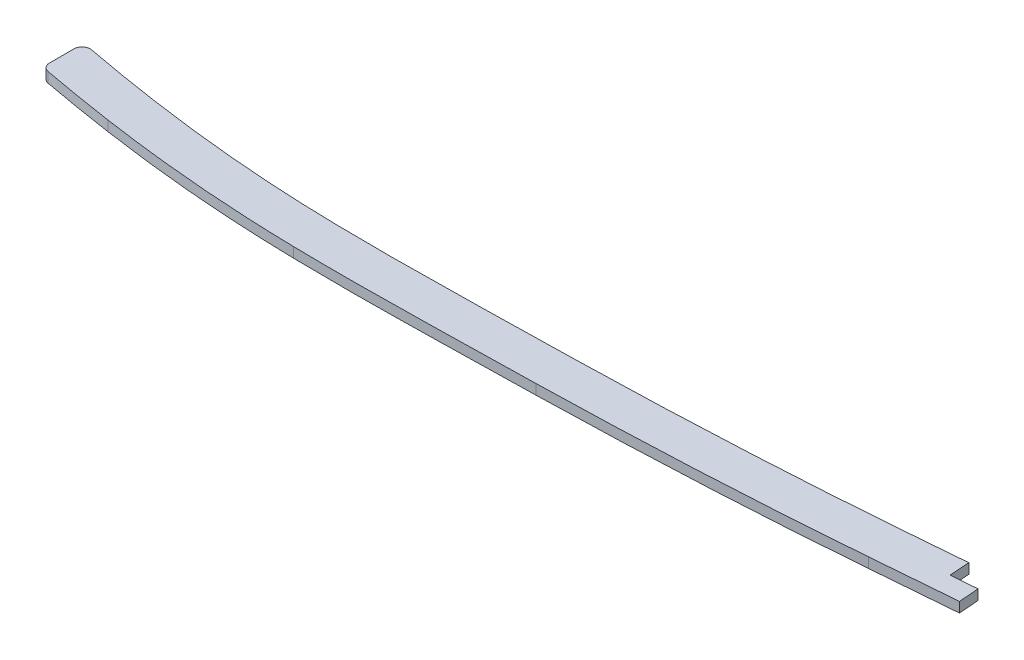
from build123d import *

# Parameters (mm, degrees)
BOSS_EXTRUDE1_START = -1.5875
BOSS_EXTRUDE1_DEPTH = 3.175
FILLET1_R           = 2.54
CUT_EXTRUDE1_DEPTH  = 10.16


# Read off the part's stored shape, not the designer's step: Boss-Extrude1
with BuildPart() as part:
    # Boss-Extrude1 outline → Boss-Extrude1 (new body)
    with BuildSketch(Plane(origin=(0, 0, 0), x_dir=(1, 0, 0), z_dir=(0, 1, 0)).offset(BOSS_EXTRUDE1_START)):
        with BuildLine():
            add(Edge.make_bspline(
                [(701.573370465, -71.674259434), (702.04697488, -71.626796619), (702.961854911, -71.534187022), (704.527211696, -71.372087014), (706.256268563, -71.189411511), (708.433468196, -70.954566837), (711.038260137, -70.66442021), (715.259153852, -70.176918919), (720.517449562, -69.537326192), (728.939784684, -68.449094171), (739.471043309, -66.973596397), (752.121699379, -65.058370184), (764.774270693, -63.022725712), (775.332382372, -61.245644149), (783.768221701, -59.789793136), (790.217423582, -58.659365862), (795.556531692, -57.710632329), (799.706029598, -56.965839367), (801.743713725, -56.597532565), (802.76701547, -56.411910209)],
                knots=[1.1996e-05, 1.1996e-05, 1.1996e-05, 1.1996e-05, 0.015636808, 0.031261621, 0.046886433, 0.062511246, 0.093760871, 0.125010496, 0.187509746, 0.250008997, 0.375007497, 0.500005998, 0.625004498, 0.750002999, 0.812502249, 0.875001499, 0.93750075, 0.968750375, 1, 1, 1, 1], degree=3))
            add(Edge.make_bspline(
                [(696.057912544, -72.218303811), (696.516819195, -72.173843609), (697.434189716, -72.08448281), (698.812500771, -71.948951554), (700.191895387, -71.812223809), (701.113019016, -71.720314305), (701.573370465, -71.674259434)],
                knots=[0.000436824, 0.000436824, 0.000436824, 0.000436824, 0.250279009, 0.500121194, 0.749963378, 0.999805563, 0.999805563, 0.999805563, 0.999805563], degree=3))
            add(Edge.make_bspline(
                [(684.465771861, -73.258588893), (685.427037387, -73.178353817), (687.338409796, -73.01607439), (690.270265001, -72.757917882), (693.135698373, -72.496722872), (695.087462196, -72.311946881), (696.057912544, -72.218303811)],
                knots=[-3.996e-06, -3.996e-06, -3.996e-06, -3.996e-06, 0.249945754, 0.499895504, 0.749845254, 0.999795004, 0.999795004, 0.999795004, 0.999795004], degree=3))
            add(Edge.make_bspline(
                [(602.42420841, -79.030202072), (604.074214061, -78.917973041), (607.327656264, -78.697993222), (612.488020924, -78.352754528), (617.82142797, -77.998720132), (624.748165187, -77.541006681), (633.288768179, -76.978079707), (643.562499486, -76.293021789), (653.811394813, -75.590339748), (662.341271598, -74.981221252), (669.157253218, -74.473896148), (673.963588211, -74.106706625), (678.141033863, -73.776630779), (681.719672317, -73.486306526), (683.554235836, -73.334679882), (684.465771861, -73.258588893)],
                knots=[4.679e-06, 4.679e-06, 4.679e-06, 4.679e-06, 0.062504419, 0.125004159, 0.1875039, 0.25000364, 0.375003121, 0.500002601, 0.625002082, 0.750001563, 0.812501303, 0.875001043, 0.937500783, 0.968750654, 1.000000524, 1.000000524, 1.000000524, 1.000000524], degree=3))
            add(Edge.make_bspline(
                [(520.17866376, -85.310815783), (520.948622537, -85.247475703), (522.472990474, -85.121954498), (525.646023872, -84.860432492), (529.954540392, -84.505420462), (535.485636827, -84.050761487), (540.7029418, -83.623505808), (545.828810606, -83.207047886), (550.972711882, -82.793890253), (556.116782859, -82.386921041), (562.976897794, -81.853433898), (571.571389273, -81.203899916), (581.568137842, -80.474939815), (590.024015055, -79.880194977), (597.052441707, -79.396103056), (600.639671821, -79.151478022), (602.42420841, -79.030202072)],
                knots=[1.3823e-05, 1.3823e-05, 1.3823e-05, 1.3823e-05, 0.031263258, 0.062512694, 0.125011564, 0.187510435, 0.250009305, 0.312508176, 0.375007046, 0.437505917, 0.500004787, 0.625002528, 0.750000269, 0.87499801, 0.937496881, 0.999995751, 0.999995751, 0.999995751, 0.999995751], degree=3))
            add(Edge.make_bspline(
                [(421.564796931, -90.347249187), (422.61109619, -90.324190198), (424.721066812, -90.275643156), (427.781390104, -90.199626606), (430.822063258, -90.118782847), (434.941029322, -90.002532976), (440.08484045, -89.844168641), (452.427619866, -89.421521336), (466.822115937, -88.804267378), (483.25535308, -87.910089241), (493.52068453, -87.276342604), (501.726177762, -86.718361924), (507.872215251, -86.275368153), (512.780927318, -85.902800926), (516.950869137, -85.573515025), (519.108912611, -85.398645627), (520.17866376, -85.310815783)],
                knots=[7.203e-06, 7.203e-06, 7.203e-06, 7.203e-06, 0.031256675, 0.062506146, 0.093755618, 0.125005089, 0.187504032, 0.250002975, 0.499998747, 0.624996633, 0.749994519, 0.812493462, 0.874992405, 0.937491348, 0.968740819, 0.999990291, 0.999990291, 0.999990291, 0.999990291], degree=3))
            add(Edge.make_bspline(
                [(346.714675087, -91.169822314), (347.184634959, -91.179549272), (348.149283989, -91.198362445), (349.881001429, -91.228640124), (351.370820969, -91.250109563), (353.638345707, -91.276445536), (356.741777131, -91.30289862), (360.603346067, -91.318288447), (365.253131479, -91.312388009), (369.910166762, -91.284169995), (376.135587827, -91.222367993), (383.937832745, -91.109503558), (391.757720532, -90.96544109), (398.23665113, -90.836219907), (403.230594411, -90.734014325), (408.182903858, -90.630969164), (412.914025095, -90.531986169), (416.611599734, -90.454119205), (419.474951766, -90.392792196), (420.864689854, -90.36259776), (421.564796931, -90.347249187)],
                knots=[1.1e-08, 1.1e-08, 1.1e-08, 1.1e-08, 0.015624829, 0.031249657, 0.062499315, 0.093748972, 0.12499863, 0.187497945, 0.24999726, 0.312496575, 0.37499589, 0.49999452, 0.62499315, 0.687492464, 0.749991779, 0.812491094, 0.874990409, 0.937489724, 0.968739382, 0.999989039, 0.999989039, 0.999989039, 0.999989039], degree=3))
            add(Edge.make_bspline(
                [(284.660180705, -86.02436228), (285.273667186, -86.114656759), (286.466569449, -86.288293963), (288.463107874, -86.571590524), (290.46491743, -86.848444068), (293.02699573, -87.19252046), (296.252166304, -87.606710304), (301.400962421, -88.226261718), (307.844767088, -88.921476193), (315.590478493, -89.626291032), (322.05207179, -90.106744711), (327.225920355, -90.425587153), (330.470644664, -90.599377294), (333.059733967, -90.723413499), (335.02192621, -90.809363102), (336.835778016, -90.883623075), (338.1694462, -90.935956115), (339.489700776, -90.98142965), (341.397886756, -91.039617592), (343.443225624, -91.094945655), (345.255837503, -91.138480537), (346.23440638, -91.159881953), (346.714675087, -91.169822314)],
                knots=[0, 0, 0, 0, 0.03125, 0.0625, 0.09375, 0.125, 0.1875, 0.25, 0.375, 0.5, 0.625, 0.6875, 0.75, 0.78125, 0.8125, 0.84375, 0.875, 0.90625, 0.9375, 0.96875, 0.984375, 1, 1, 1, 1], degree=3))
            add(Edge.make_bspline(
                [(258.083552795, -81.475395447), (258.347968296, -81.526862936), (258.876883054, -81.629439687), (259.670508063, -81.782232521), (260.729004783, -81.984533344), (265.19336261, -82.828339408), (273.252215122, -84.264018509), (280.795301047, -85.455519597), (284.660180705, -86.02436228)],
                knots=[0.425011658, 0.425011658, 0.425011658, 0.425011658, 0.442241189, 0.459470721, 0.476700252, 0.511159315, 0.75, 1, 1, 1, 1], degree=3))
            Line((258.083552795, -81.475395447), (258.083552795, -94.40861288))
            add(Edge.make_bspline(
                [(282.810885884, -98.588999508), (274.906267762, -97.425577983), (267.032082315, -96.096692803), (258.818160589, -94.548151889), (258.450825612, -94.478551371), (258.083552795, -94.40861288)],
                knots=[0, 0, 0, 0, 0.5, 0.5, 0.523411439, 0.523411439, 0.523411439, 0.523411439], degree=3))
            add(Edge.make_bspline(
                [(282.810885884, -98.588999508), (283.589001764, -98.703524555), (285.164508504, -98.932181064), (287.829592849, -99.306686744), (290.382113422, -99.652796041), (292.96654593, -99.989964246), (295.582618612, -100.317621114), (298.230083081, -100.634886778), (300.908649594, -100.941019762), (303.61800528, -101.235303734), (306.357810596, -101.517085869), (309.127700691, -101.785780175), (311.92729165, -102.040857239), (316.290106771, -102.412643883), (322.527800913, -102.877083333), (328.625603501, -103.227822262), (333.380129051, -103.452212237), (336.816790701, -103.594408746), (339.260438836, -103.686034081), (343.688375923, -103.809905452), (346.451873128, -103.867102934)],
                knots=[0, 0, 0, 0, 0.039344948, 0.07917436, 0.119484401, 0.160271019, 0.201529957, 0.243256752, 0.285446746, 0.328095093, 0.37119677, 0.414746584, 0.458739194, 0.503169123, 0.620303495, 0.752369719, 0.789892337, 0.843756099, 0.913843268, 1, 1, 1, 1], degree=3))
            add(Edge.make_bspline(
                [(346.451873128, -103.867102934), (347.517721695, -103.889163254), (349.542313965, -103.92559437), (351.410670783, -103.951601003), (353.733077388, -103.97802022), (356.595805361, -104.001616052), (359.303450326, -104.013254143), (361.856652408, -104.015647305), (363.59855953, -104.013876583), (367.980988834, -104.00146953), (374.772600805, -103.943346872), (385.553908564, -103.787153573), (397.279033824, -103.561287268), (410.957604412, -103.27591363), (418.412993695, -103.119398813), (421.843885938, -103.044182276)],
                knots=[0, 0, 0, 0, 0.033933195, 0.066295354, 0.097094988, 0.12634023, 0.180197875, 0.204824218, 0.227923989, 0.249502809, 0.379187752, 0.498147003, 0.678500622, 0.845778388, 1, 1, 1, 1], degree=3))
            add(Edge.make_bspline(
                [(421.843885938, -103.044182276), (423.284501257, -103.01243375), (426.138074601, -102.945774905), (430.23392379, -102.840101392), (434.371968877, -102.72425222), (439.798819101, -102.559925422), (448.025157593, -102.283759658), (459.021003941, -101.848637215), (471.45249354, -101.271082202), (483.913686147, -100.593406887), (494.231772367, -99.956980278), (502.466387344, -99.39745886), (508.578998405, -98.957752379), (514.573610191, -98.503827918), (518.958126171, -98.153760061), (521.218891036, -97.968142841)],
                knots=[0, 0, 0, 0, 0.042442699, 0.084473439, 0.126075796, 0.167232557, 0.248140272, 0.374197286, 0.498957981, 0.623287397, 0.750390596, 0.810583593, 0.872090979, 0.935130561, 1, 1, 1, 1], degree=3))
            add(Edge.make_bspline(
                [(521.218891036, -97.968142841), (523.451350188, -97.784491424), (528.137879673, -97.397889698), (536.731309482, -96.690817555), (544.954460679, -96.018267543), (553.50407331, -95.33057133), (563.716480518, -94.531063336), (575.636513939, -93.635190253), (588.786212869, -92.692538058), (598.347131864, -92.036570917), (603.285671904, -91.700951094)],
                knots=[0, 0, 0, 0, 0.091538543, 0.187736577, 0.288050862, 0.392265043, 0.500367872, 0.66142166, 0.827962884, 1, 1, 1, 1], degree=3))
            add(Edge.make_bspline(
                [(603.285671904, -91.700951094), (605.78808228, -91.530743591), (610.897032353, -91.186403467), (619.306599861, -90.627823918), (627.538601032, -90.084789882), (635.936476676, -89.530098998), (643.719546666, -89.009847824), (650.893783861, -88.520535985), (657.46530725, -88.061941255), (664.220349455, -87.576914876), (671.158631923, -87.060362733), (677.768426526, -86.549575155), (682.892578542, -86.13408317), (685.522190682, -85.9145748)],
                knots=[0, 0, 0, 0, 0.096041268, 0.194096291, 0.29416615, 0.396252661, 0.500358628, 0.578021943, 0.657927659, 0.740076076, 0.824468696, 0.911108458, 1, 1, 1, 1], degree=3))
            add(Edge.make_bspline(
                [(685.522190682, -85.9145748), (686.483363358, -85.834347474), (688.416317483, -85.670266195), (691.375399642, -85.409794673), (694.295027309, -85.143745348), (696.281480154, -84.95572275), (697.280162315, -84.859352478)],
                knots=[0, 0, 0, 0, 0.247890437, 0.497182912, 0.747883707, 1, 1, 1, 1], degree=3))
            add(Edge.make_bspline(
                [(697.280162315, -84.859352478), (699.133498258, -84.679799353), (700.986276607, -84.496390936), (702.838684367, -84.311070025)],
                knots=[0, 0, 0, 0, 1, 1, 1, 1], degree=3))
            add(Edge.make_bspline(
                [(702.838684367, -84.311070025), (703.589775295, -84.235799752), (705.133492987, -84.078629058), (708.047466313, -83.771407142), (710.748991263, -83.476233306), (713.523455705, -83.162791229), (716.37085234, -82.830812164), (719.291149506, -82.479719712), (722.284334057, -82.109050619), (725.350396028, -81.718303946), (730.760173437, -81.009658613), (740.331799838, -79.683632118), (753.598097399, -77.68903736), (767.27468421, -75.481732644), (778.677358422, -73.559116698), (788.170711893, -71.915943965), (796.891357387, -70.375844053), (802.366731643, -69.391771369), (805.033747795, -68.907986576)],
                knots=[0, 0, 0, 0, 0.024848372, 0.050416521, 0.076704883, 0.103713975, 0.131444397, 0.159896834, 0.189072062, 0.218970945, 0.249594443, 0.347406526, 0.499390399, 0.638902952, 0.749436379, 0.834969029, 0.918499168, 1, 1, 1, 1], degree=3))
            Line((805.033747795, -68.907986576), (806.809551789, -68.578936168))
            add(Edge.make_bspline(
                [(806.809551789, -68.578936168), (807.794004822, -68.395119755), (809.726191369, -68.029713589), (811.766757719, -67.634799792), (814.185248792, -67.158567155), (816.55886725, -66.68111941), (820.369254046, -65.898841142), (824.807312319, -64.951185469), (829.827239229, -63.826217582), (833.268092373, -63.026324522), (835.935211118, -62.389425037), (837.873162846, -61.91853539), (839.769381429, -61.449895816), (841.624127129, -60.983575945), (843.734931971, -60.443149682), (844.733875611, -60.183258894), (845.223156672, -60.055102096)],
                knots=[0, 0, 0, 0, 0.064848776, 0.128591831, 0.191223632, 0.252742215, 0.313148507, 0.487734154, 0.598660779, 0.705288655, 0.75701083, 0.807682273, 0.85731034, 0.905901891, 0.953463218, 1, 1, 1, 1], degree=3))
            add(Edge.make_bspline(
                [(858.805970467, -56.257210913), (854.302265416, -57.602424975), (849.773135735, -58.863331563), (845.223156672, -60.055102096)],
                knots=[0.525572557, 0.525572557, 0.525572557, 0.525572557, 1, 1, 1, 1], degree=3))
            Line((858.805970467, -56.257210913), (858.805970467, -42.981654463))
            add(Edge.make_bspline(
                [(842.005216089, -47.769547229), (844.33209519, -47.160070589), (848.630876213, -45.996859499), (853.420502494, -44.614540459), (856.161610787, -43.791878163), (857.220661541, -43.470009626), (858.013965236, -43.226852548), (858.542087125, -43.063586295), (858.805970467, -42.981654463)],
                knots=[0, 0, 0, 0, 0.25, 0.462204418, 0.52007177, 0.549005446, 0.577939123, 0.606872799, 0.606872799, 0.606872799, 0.606872799], degree=3))
            add(Edge.make_bspline(
                [(804.478503109, -56.094697623), (804.937261418, -56.009038578), (805.873535899, -55.833158182), (807.593890186, -55.506511486), (809.223478159, -55.191529302), (811.577863033, -54.728351346), (814.728198308, -54.095426794), (818.65467417, -53.281335813), (823.355137668, -52.264852214), (828.043123472, -51.207419322), (831.9339187, -50.292144023), (835.047083584, -49.53591133), (836.970069876, -49.058975401), (838.551971708, -48.659746263), (839.885294081, -48.319263071), (841.0585054, -48.016793361), (841.676038434, -47.855768334), (842.005216089, -47.769547229)],
                knots=[0, 0, 0, 0, 0.03125, 0.0625, 0.125, 0.1875, 0.25, 0.375, 0.5, 0.625, 0.75, 0.8125, 0.875, 0.90625, 0.9375, 0.96875, 1, 1, 1, 1], degree=3))
            Line((804.478503109, -56.094697623), (802.76701547, -56.411910209))
        make_face()
    extrude(amount=BOSS_EXTRUDE1_DEPTH)

    # Fillet1
    fillet1_edges = [part.edges().sort_by_distance(p)[0] for p in [
        (858.805970467, 0, 42.981654463),
        (858.805970467, 0, 56.257210913),
        (258.083552795, 0, 81.475395447),
        (258.083552795, 0, 94.40861288),
    ]]
    fillet(fillet1_edges, radius=FILLET1_R)

    # Sketch3 → Cut-Extrude1 (cut)
    with BuildSketch(Plane(origin=(0, 1.5875, 0), x_dir=(1, 0, 0), z_dir=(0, 1, 0))):
        with BuildLine():
            Line((538.573908081, -83.797990994), (539.029351184, -90.069007907))
            Line((539.029351184, -90.069007907), (547.151700891, -89.47910866))
            Line((547.151700891, -89.47910866), (547.661463933, -95.801226886))
            add(Edge.make_bspline(
                [(547.661463933, -95.801226886), (549.573540603, -95.647052923), (554.442098815, -95.257135276), (563.716480518, -94.531063336), (575.636513939, -93.635190253), (588.786212869, -92.692538058), (598.347131864, -92.036570917), (603.285671904, -91.700951094)],
                knots=[0.322345551, 0.322345551, 0.322345551, 0.322345551, 0.392265043, 0.500367872, 0.66142166, 0.827962884, 1, 1, 1, 1], degree=3))
            add(Edge.make_bspline(
                [(603.285671904, -91.700951094), (605.78808228, -91.530743591), (610.897032353, -91.186403467), (619.306599861, -90.627823918), (627.538601032, -90.084789882), (635.936476676, -89.530098998), (643.719546666, -89.009847824), (650.893783861, -88.520535985), (657.46530725, -88.061941255), (664.220349455, -87.576914876), (671.158631923, -87.060362733), (677.768426526, -86.549575155), (682.892578542, -86.13408317), (685.522190682, -85.9145748)],
                knots=[0, 0, 0, 0, 0.096041268, 0.194096291, 0.29416615, 0.396252661, 0.500358628, 0.578021943, 0.657927659, 0.740076076, 0.824468696, 0.911108458, 1, 1, 1, 1], degree=3))
            add(Edge.make_bspline(
                [(685.522190682, -85.9145748), (686.483363358, -85.834347474), (688.416317483, -85.670266195), (691.375399642, -85.409794673), (694.295027309, -85.143745348), (696.281480154, -84.95572275), (697.280162315, -84.859352478)],
                knots=[0, 0, 0, 0, 0.247890437, 0.497182912, 0.747883707, 1, 1, 1, 1], degree=3))
            add(Edge.make_bspline(
                [(697.280162315, -84.859352478), (699.133498258, -84.679799353), (700.986276607, -84.496390936), (702.838684367, -84.311070025)],
                knots=[0, 0, 0, 0, 1, 1, 1, 1], degree=3))
            add(Edge.make_bspline(
                [(702.838684367, -84.311070025), (703.589775295, -84.235799752), (705.133492987, -84.078629058), (708.047466313, -83.771407142), (710.748991263, -83.476233306), (713.523455705, -83.162791229), (716.37085234, -82.830812164), (719.291149506, -82.479719712), (722.284334057, -82.109050619), (725.350396028, -81.718303946), (730.760173437, -81.009658613), (740.331799838, -79.683632118), (753.598097399, -77.68903736), (767.27468421, -75.481732644), (778.677358422, -73.559116698), (788.170711893, -71.915943965), (796.891357387, -70.375844053), (802.366731643, -69.391771369), (805.033747795, -68.907986576)],
                knots=[0, 0, 0, 0, 0.024848372, 0.050416521, 0.076704883, 0.103713975, 0.131444397, 0.159896834, 0.189072062, 0.218970945, 0.249594443, 0.347406526, 0.499390399, 0.638902952, 0.749436379, 0.834969029, 0.918499168, 1, 1, 1, 1], degree=3))
            Line((805.033747795, -68.907986576), (806.809551789, -68.578936168))
            add(Edge.make_bspline(
                [(806.809551789, -68.578936168), (807.794004822, -68.395119755), (809.726191369, -68.029713589), (811.766757719, -67.634799792), (814.185248792, -67.158567155), (816.55886725, -66.68111941), (820.369254046, -65.898841142), (824.807312319, -64.951185469), (829.827239229, -63.826217582), (833.268092373, -63.026324522), (835.935211118, -62.389425037), (837.873162846, -61.91853539), (839.769381429, -61.449895816), (841.624127129, -60.983575945), (843.734931971, -60.443149682), (844.733875611, -60.183258894), (845.223156672, -60.055102096)],
                knots=[0, 0, 0, 0, 0.064848776, 0.128591831, 0.191223632, 0.252742215, 0.313148507, 0.487734154, 0.598660779, 0.705288655, 0.75701083, 0.807682273, 0.85731034, 0.905901891, 0.953463218, 1, 1, 1, 1], degree=3))
            add(Edge.make_bspline(
                [(845.223156672, -60.055102096), (849.158938128, -59.024204428), (853.079119118, -57.941576123), (856.980738351, -56.797397641)],
                knots=[0.589615008, 0.589615008, 0.589615008, 0.589615008, 1, 1, 1, 1], degree=3))
            ThreePointArc((856.980738351, -56.797397641), (858.299078563, -55.882556759), (858.805970467, -54.360050704))
            Line((858.805970467, -54.360050704), (858.805970467, -46.412138384))
            ThreePointArc((858.805970467, -46.412138384), (857.782327313, -44.374428415), (855.536472895, -43.979149832))
            add(Edge.make_bspline(
                [(855.536472895, -43.979149832), (855.302707966, -44.049240975), (853.122392665, -44.700577003), (848.630876213, -45.996859499), (844.33209519, -47.160070589), (842.005216089, -47.769547229)],
                knots=[0, 0, 0, 0, 0.025497707, 0.237702124, 0.487702124, 0.487702124, 0.487702124, 0.487702124], degree=3))
            add(Edge.make_bspline(
                [(842.005216089, -47.769547229), (841.676038434, -47.855768334), (841.0585054, -48.016793361), (839.885294081, -48.319263071), (838.551971708, -48.659746263), (836.970069876, -49.058975401), (835.047083584, -49.53591133), (831.9339187, -50.292144023), (828.043123472, -51.207419322), (823.355137668, -52.264852214), (818.65467417, -53.281335813), (814.728198308, -54.095426794), (811.577863033, -54.728351346), (809.223478159, -55.191529302), (807.593890186, -55.506511486), (805.873535899, -55.833158182), (804.937261418, -56.009038578), (804.478503109, -56.094697623)],
                knots=[0, 0, 0, 0, 0.03125, 0.0625, 0.09375, 0.125, 0.1875, 0.25, 0.375, 0.5, 0.625, 0.75, 0.8125, 0.875, 0.9375, 0.96875, 1, 1, 1, 1], degree=3))
            Line((804.478503109, -56.094697623), (802.76701547, -56.411910209))
            add(Edge.make_bspline(
                [(802.76701547, -56.411910209), (801.743713725, -56.597532565), (799.706029598, -56.965839367), (795.556531692, -57.710632329), (790.217423582, -58.659365862), (783.768221701, -59.789793136), (775.332382372, -61.245644149), (764.774270693, -63.022725712), (752.121699379, -65.058370184), (739.471043309, -66.973596397), (728.939784684, -68.449094171), (720.517449562, -69.537326192), (715.259153852, -70.176918919), (711.038260137, -70.66442021), (708.433468196, -70.954566837), (706.256268563, -71.189411511), (704.527211696, -71.372087014), (702.961854911, -71.534187022), (702.04697488, -71.626796619), (701.573370465, -71.674259434)],
                knots=[1.1996e-05, 1.1996e-05, 1.1996e-05, 1.1996e-05, 0.031261621, 0.062511246, 0.125010496, 0.187509746, 0.250008997, 0.375007497, 0.500005998, 0.625004498, 0.750002999, 0.812502249, 0.875001499, 0.906251125, 0.93750075, 0.953125562, 0.968750375, 0.984375187, 1, 1, 1, 1], degree=3))
            add(Edge.make_bspline(
                [(701.573370465, -71.674259434), (701.113019016, -71.720314305), (700.191895387, -71.812223809), (698.812500771, -71.948951554), (697.434189716, -72.08448281), (696.516819195, -72.173843609), (696.057912544, -72.218303811)],
                knots=[0.000436824, 0.000436824, 0.000436824, 0.000436824, 0.250279009, 0.500121194, 0.749963378, 0.999805563, 0.999805563, 0.999805563, 0.999805563], degree=3))
            add(Edge.make_bspline(
                [(696.057912544, -72.218303811), (695.087462196, -72.311946881), (693.135698373, -72.496722872), (690.270265001, -72.757917882), (687.338409796, -73.01607439), (685.427037387, -73.178353817), (684.465771861, -73.258588893)],
                knots=[-3.996e-06, -3.996e-06, -3.996e-06, -3.996e-06, 0.249945754, 0.499895504, 0.749845254, 0.999795004, 0.999795004, 0.999795004, 0.999795004], degree=3))
            add(Edge.make_bspline(
                [(684.465771861, -73.258588893), (683.554235836, -73.334679882), (681.719672317, -73.486306526), (678.141033863, -73.776630779), (673.963588211, -74.106706625), (669.157253218, -74.473896148), (662.341271598, -74.981221252), (653.811394813, -75.590339748), (643.562499486, -76.293021789), (633.288768179, -76.978079707), (624.748165187, -77.541006681), (617.82142797, -77.998720132), (612.488020924, -78.352754528), (607.327656264, -78.697993222), (604.074214061, -78.917973041), (602.42420841, -79.030202072)],
                knots=[4.679e-06, 4.679e-06, 4.679e-06, 4.679e-06, 0.031254549, 0.062504419, 0.125004159, 0.1875039, 0.25000364, 0.375003121, 0.500002601, 0.625002082, 0.750001563, 0.812501303, 0.875001043, 0.937500783, 1.000000524, 1.000000524, 1.000000524, 1.000000524], degree=3))
            add(Edge.make_bspline(
                [(602.42420841, -79.030202072), (600.639671821, -79.151478022), (597.052441707, -79.396103056), (590.024015055, -79.880194977), (581.568137842, -80.474939815), (571.571389273, -81.203899916), (562.976897794, -81.853433898), (556.116782859, -82.386921041), (550.972711882, -82.793890253), (545.828810606, -83.207047886), (541.716519062, -83.541156396), (539.282690998, -83.740007149), (538.573908081, -83.797990994)],
                knots=[1.3823e-05, 1.3823e-05, 1.3823e-05, 1.3823e-05, 0.062512694, 0.125011564, 0.250009305, 0.375007046, 0.500004787, 0.562503658, 0.625002528, 0.687501399, 0.750000269, 0.775424, 0.775424, 0.775424, 0.775424], degree=3))
        make_face()
    extrude(amount=-CUT_EXTRUDE1_DEPTH, mode=Mode.SUBTRACT)


with BuildPart() as cut_extrude1_kept_piece:
    # of the separate pieces the step leaves, the one the design keeps (cut_extrude1_pieces_kept)
    add(part.part.solids().sort_by_distance((520.17866376, -1.5875, 85.310815783))[0])


solid = cut_extrude1_kept_piece.part
